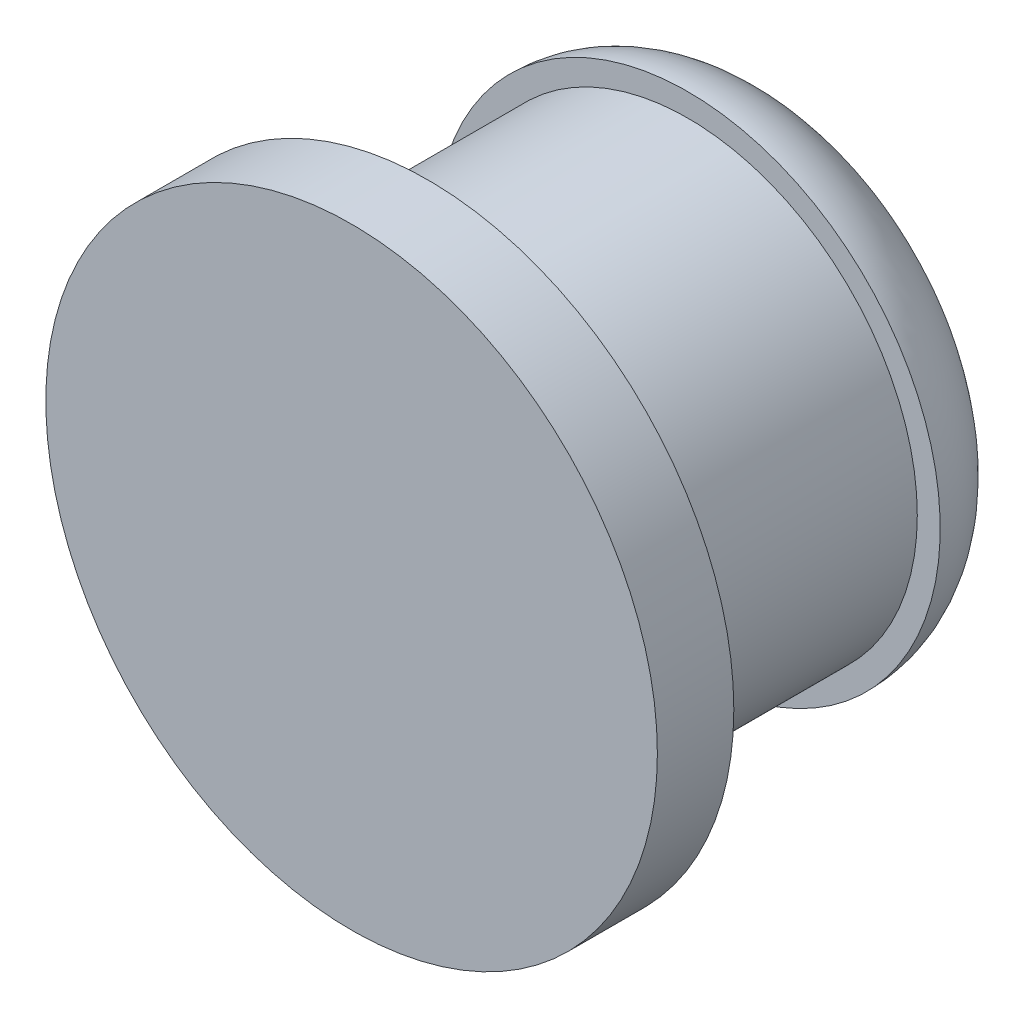
from build123d import *

# Parameters (mm, degrees)
IZIM1_R                     = 2
Y_KSEKLIK_EKSTR_ZYON1_DEPTH = 0.5
IZIM2_R                     = 1.5
Y_KSEKLIK_EKSTR_ZYON2_DEPTH = 1.7
IZIM3_R                     = 1.65
Y_KSEKLIK_EKSTR_ZYON3_DEPTH = 0.6
RADYUS1_R                   = 0.6


with BuildPart() as part:
    # Çizim1 → Yükseklik-Ekstrüzyon1 (new body)
    with BuildSketch(Plane.XY):
        with Locations((21.571512145, 0)):
            Circle(IZIM1_R)
    extrude(amount=Y_KSEKLIK_EKSTR_ZYON1_DEPTH)

    # Çizim2 → Yükseklik-Ekstrüzyon2 (add)
    with BuildSketch(Plane(origin=(0, 0, 0), x_dir=(-1, 0, 0), z_dir=(0, 0, -1))):
        with Locations(Location((-21.571512145, 0, 0), (0, 0, 180))):
            Circle(IZIM2_R)
    extrude(amount=Y_KSEKLIK_EKSTR_ZYON2_DEPTH)

    # Çizim3 → Yükseklik-Ekstrüzyon3 (add)
    with BuildSketch(Plane(origin=(0, 0, -1.7), x_dir=(-1, 0, 0), z_dir=(0, 0, -1))):
        with Locations((-21.571512145, 0)):
            Circle(IZIM3_R)
    extrude(amount=Y_KSEKLIK_EKSTR_ZYON3_DEPTH)

    # Radyus1
    radyus1_edges = [part.edges().sort_by_distance(p)[0] for p in [
        (23.221512145, 0, -2.3),
    ]]
    fillet(radyus1_edges, radius=RADYUS1_R - 0.0001)  # a hair under: the kernel refuses the full size


solid = part.part
